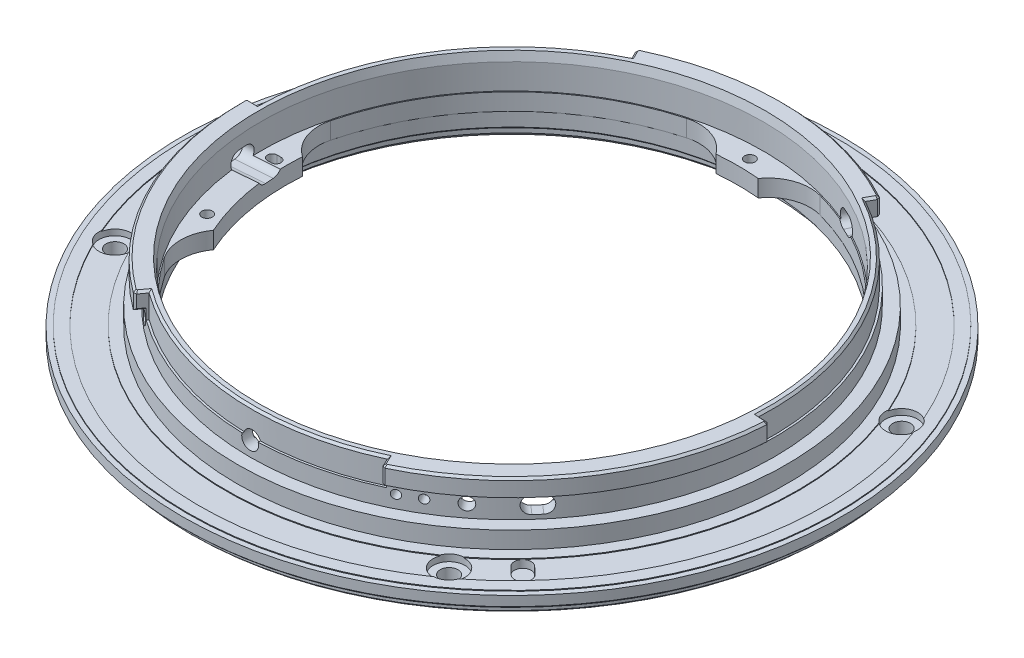
from build123d import *

# Parameters (mm, degrees)
SKETCH1_R                                        = 39
BOSS_EXTRUDE1_DEPTH                              = 2.5
SKETCH6_R                                        = 32.5
BOSS_EXTRUDE2_DEPTH                              = 7
CUT_EXTRUDE1_START                               = -0.1
SKETCH2_R                                        = 39
SKETCH2_R_2                                      = 38.4
CUT_EXTRUDE1_DEPTH                               = 0.1
SKETCH7_R                                        = 37
SKETCH7_R_2                                      = 33.8
CUT_EXTRUDE5_DEPTH                               = 0.1
SKETCH3_R                                        = 39
SKETCH3_R_2                                      = 38.15
CUT_EXTRUDE2_DEPTH                               = 1
SKETCH4_R                                        = 30.75
CUT_EXTRUDE3_DEPTH                               = 1.55
CUT_EXTRUDE4_START                               = 1.55
SKETCH5_R                                        = 29.75
CUT_EXTRUDE4_DEPTH                               = 3.5
CHAMFER1_SIZE                                    = 0.5
CHAMFER2_SIZE                                    = 0.25
CHAMFER3_SIZE                                    = 0.25
CUT_EXTRUDE6_START                               = -4
SKETCH11_R                                       = 29.75
CUT_EXTRUDE6_DEPTH                               = 4
CUT_EXTRUDE7_DEPTH                               = 56.479726027
M1_6X0_35_TAPPED_HOLE1_D                         = 1.25
F_1_0MM_DOWEL_HOLE2_D                            = 1
F_1_0MM_START                                    = 3.5
F_1_0MM_DOWEL_SLOT2_DEPTH                        = 2
CBORE_FOR_M2_PAN_HEAD_MACHINE_SCREW1_D           = 2.1
CBORE_FOR_M2_PAN_HEAD_MACHINE_SCREW1_CBORE_D     = 3.8
CBORE_FOR_M2_PAN_HEAD_MACHINE_SCREW1_CBORE_DEPTH = 0.8
CUT_EXTRUDE14_DEPTH                              = 56.596762496
CUT_EXTRUDE14_DEPTH_BACK                         = 1
CHAMFER4_SIZE                                    = 0.25
CHAMFER4_SIZE2                                   = 1
SKETCH17_R                                       = 32.5
SKETCH17_R_2                                     = 31
CUT_EXTRUDE8_DEPTH                               = 3
CUT_EXTRUDE9_START                               = -3
SKETCH18_R                                       = 104.133700614
CUT_EXTRUDE9_DEPTH                               = 3
CUT_EXTRUDE11_REACH                              = 88.314
CUT_EXTRUDE12_REACH                              = 87.209
CUT_EXTRUDE13_REACH                              = 83.453
CUT_EXTRUDE15_REACH                              = 82.355
SKETCH36_R                                       = 1
CUT_EXTRUDE16_REACH                              = 88.215
SKETCH38_R                                       = 0.75
CUT_EXTRUDE17_REACH                              = 88.215
SKETCH39_R                                       = 0.75
CUT_EXTRUDE18_REACH                              = 87.796
CUT_EXTRUDE18_END_RADIUS                         = 29.75
SKETCH40_R                                       = 0.5
CUT_EXTRUDE19_REACH                              = 87.36
CUT_EXTRUDE19_END_RADIUS                         = 29.75
SKETCH41_R                                       = 0.5
CHAMFER5_SIZE                                    = 0.25
CHAMFER6_SIZE                                    = 0.25
CHAMFER7_SIZE                                    = 0.25


# Read off the part's stored shape, not the designer's step: Ø1.0mm Dowel Slot2
with BuildPart() as part:
    # Sketch1 → Boss-Extrude1 (new body)
    with BuildSketch(Plane(origin=(0, 0, 0), x_dir=(1, 0, 0), z_dir=(0, 1, 0))):
        with Locations(Location((0, 0, 0), (0, 0, 270))):
            Circle(SKETCH1_R)
    extrude(amount=BOSS_EXTRUDE1_DEPTH)

    # Sketch6 → Boss-Extrude2 (add)
    with BuildSketch(Plane(origin=(0, 2.5, 0), x_dir=(1, 0, 0), z_dir=(0, 1, 0))):
        with Locations(Location((0, 0, 0), (0, 0, 270))):
            Circle(SKETCH6_R)
    extrude(amount=BOSS_EXTRUDE2_DEPTH)

    # Sketch2 → Cut-Extrude1 (cut)
    with BuildSketch(Plane(origin=(0, 2.5, 0), x_dir=(1, 0, 0), z_dir=(0, 1, 0)).offset(CUT_EXTRUDE1_START)):
        with Locations(Location((0, 0, 0), (0, 0, 270))):
            Circle(SKETCH2_R)
        with Locations(Location((0, 0, 0), (0, 0, 270))):
            Circle(SKETCH2_R_2, mode=Mode.SUBTRACT)
    extrude(amount=CUT_EXTRUDE1_DEPTH, mode=Mode.SUBTRACT)

    # Sketch7 → Cut-Extrude5 (cut)
    with BuildSketch(Plane(origin=(0, 2.5, 0), x_dir=(1, 0, 0), z_dir=(0, 1, 0))):
        with Locations(Location((0, 0, 0), (0, 0, 270))):
            Circle(SKETCH7_R)
        with Locations(Location((0, 0, 0), (0, 0, 270))):
            Circle(SKETCH7_R_2, mode=Mode.SUBTRACT)
    extrude(amount=-CUT_EXTRUDE5_DEPTH, mode=Mode.SUBTRACT)

    # Sketch3 → Cut-Extrude2 (cut)
    with BuildSketch(Plane.XZ):
        with Locations(Location((0, 0, 0), (0, 0, 270))):
            Circle(SKETCH3_R)
        with Locations(Location((0, 0, 0), (0, 0, 270))):
            Circle(SKETCH3_R_2, mode=Mode.SUBTRACT)
    extrude(amount=-CUT_EXTRUDE2_DEPTH, mode=Mode.SUBTRACT)

    # Sketch4 → Cut-Extrude3 (cut)
    with BuildSketch(Plane.XZ):
        with Locations(Location((0, 0, 0), (0, 0, 270))):
            Circle(SKETCH4_R)
    extrude(amount=-CUT_EXTRUDE3_DEPTH, mode=Mode.SUBTRACT)

    # Sketch5 → Cut-Extrude4 (cut)
    with BuildSketch(Plane.XZ.offset(-1.55).offset(CUT_EXTRUDE4_START)):
        with Locations(Location((0, 0, 0), (0, 0, 270))):
            Circle(SKETCH5_R)
    extrude(amount=-CUT_EXTRUDE4_DEPTH, mode=Mode.SUBTRACT)

    # Chamfer1
    chamfer1_edges = [part.edges().sort_by_distance(p)[0] for p in [
        (0, 0, 30.75),
    ]]
    chamfer(chamfer1_edges, length=CHAMFER1_SIZE)

    # Chamfer2
    chamfer2_edges = [part.edges().sort_by_distance(p)[0] for p in [
        (0, 1.55, 29.75),
    ]]
    chamfer(chamfer2_edges, length=CHAMFER2_SIZE)

    # Chamfer3
    chamfer3_edges = [part.edges().sort_by_distance(p)[0] for p in [
        (0, 1, -39),
        (0, 0, 38.15),
    ]]
    chamfer(chamfer3_edges, length=CHAMFER3_SIZE)

    # Sketch11 → Cut-Extrude6 (cut)
    with BuildSketch(Plane(origin=(0, 9.5, 0), x_dir=(1, 0, 0), z_dir=(0, 1, 0)).offset(CUT_EXTRUDE6_START)):
        with Locations(Location((0, 0, 0), (0, 0, 90))):
            Circle(SKETCH11_R)
    extrude(amount=CUT_EXTRUDE6_DEPTH, mode=Mode.SUBTRACT)

    # Sketch10 → Cut-Extrude7 (cut, through all)
    with BuildSketch(Plane.XZ.offset(-3.5)):
        with BuildLine():
            ThreePointArc((24.42534022, 10.907119471), (25.371160244, 13.762107574), (24.508061845, 16.643182676))
            ThreePointArc((24.508061845, 16.643182676), (0, 29.625), (-24.508061845, 16.643182676))
            ThreePointArc((-24.508061845, 16.643182676), (-25.371160244, 13.762107574), (-24.42534022, 10.907119471))
            ThreePointArc((-24.42534022, 10.907119471), (-26.343607393, 4.645088753), (-26.682766529, -1.895381318))
            ThreePointArc((-26.682766529, -1.895381318), (-28.548010067, -4.254703071), (-28.72234859, -7.257225122))
            ThreePointArc((-28.72234859, -7.257225122), (-21.184234387, -20.709148665), (-7.906718086, -28.550384132))
            ThreePointArc((-7.906718086, -28.550384132), (-4.901014594, -28.444181003), (-2.5, -26.632921357))
            ThreePointArc((-2.5, -26.632921357), (0, -26.75), (2.5, -26.632921357))
            ThreePointArc((2.5, -26.632921357), (4.901014594, -28.444181003), (7.906718086, -28.550384132))
            ThreePointArc((7.906718086, -28.550384132), (21.184234387, -20.709148665), (28.72234859, -7.257225122))
            ThreePointArc((28.72234859, -7.257225122), (28.548010067, -4.254703071), (26.682766529, -1.895381318))
            ThreePointArc((26.682766529, -1.895381318), (26.343607393, 4.645088753), (24.42534022, 10.907119471))
        make_face()
    extrude(amount=-CUT_EXTRUDE7_DEPTH, mode=Mode.SUBTRACT)

    # M1.6x0.35 Tapped Hole1 (through all)
    with Locations(Plane(origin=(0, 3.5, -28.147502082), x_dir=(0, 0, -1), z_dir=(0, -1, 0))):
        with Locations((0, 0), (-37.774514778, 26.45), (-37.774514778, -26.45)):
            Hole(M1_6X0_35_TAPPED_HOLE1_D / 2)

    # Ø1.0mm Dowel Hole2 (through all)
    with Locations(Plane(origin=(28.147502082, 3.5, 0), x_dir=(0, 0, -1), z_dir=(0, -1, 0))):
        with Locations((0, 0)):
            Hole(F_1_0MM_DOWEL_HOLE2_D / 2)

    # Ø1.0mm Dowel Slot2 outline → Ø1.0mm Dowel Slot2 (cut)
    with BuildSketch(Plane(origin=(0, 0, 0), x_dir=(1, 0, 0), z_dir=(0, 1, 0)).offset(F_1_0MM_START)):
        with BuildLine():
            ThreePointArc((-27.922502082, -0.575), (-27.347502082, 0), (-27.922502082, 0.575))
            Line((-27.922502082, 0.575), (-28.372502082, 0.575))
            ThreePointArc((-28.372502082, 0.575), (-28.947502082, 0), (-28.372502082, -0.575))
            Line((-28.372502082, -0.575), (-27.922502082, -0.575))
        make_face()
    extrude(amount=F_1_0MM_DOWEL_SLOT2_DEPTH, mode=Mode.SUBTRACT)

    # CBORE for M2 Pan Head Machine Screw1 (through all)
    with Locations(Plane(origin=(-15.18302896, 2.5, -31.978674638), x_dir=(0, 0, 1), z_dir=(0, 1, 0))):
        with Locations((0, 0), (18.683355915, 47.991480616), (60.454624943, 36.213489113), (46.825556763, -16.953089212)):
            CounterBoreHole(CBORE_FOR_M2_PAN_HEAD_MACHINE_SCREW1_D / 2, CBORE_FOR_M2_PAN_HEAD_MACHINE_SCREW1_CBORE_D / 2, CBORE_FOR_M2_PAN_HEAD_MACHINE_SCREW1_CBORE_DEPTH)

    # Sketch34 → Cut-Extrude14 (cut, two sides: drawn at the far end of the back side and taken through both)
    with BuildSketch(Plane(origin=(0, 2.5, 0), x_dir=(1, 0, 0), z_dir=(0, 1, 0)).offset(-CUT_EXTRUDE14_DEPTH_BACK)):
        with BuildLine():
            Line((25.416105281, -25.515124776), (24.545948074, -24.68879165))
            ThreePointArc((24.545948074, -24.68879165), (24.509428006, -23.275049706), (25.92316995, -23.238529638))
            Line((25.92316995, -23.238529638), (26.793327157, -24.064862764))
            ThreePointArc((26.793327157, -24.064862764), (26.829847225, -25.478604708), (25.416105281, -25.515124776))
        make_face()
    extrude(amount=CUT_EXTRUDE14_DEPTH + CUT_EXTRUDE14_DEPTH_BACK, mode=Mode.SUBTRACT)

    # Chamfer4
    chamfer4_edges = [part.edges().sort_by_distance(p)[0] for p in [
        (0, 9.5, 29.75),
    ]]
    chamfer4_side = [part.faces().sort_by_distance(p)[0] for p in [
        (0, 9.5, -31.580761184),
    ]]
    chamfer(chamfer4_edges, length=CHAMFER4_SIZE, length2=CHAMFER4_SIZE2, reference=chamfer4_side[0])

    # Sketch17 → Cut-Extrude8 (cut)
    with BuildSketch(Plane(origin=(0, 4.5, 0), x_dir=(1, 0, 0), z_dir=(0, 1, 0))):
        with Locations(Location((0, 0, 0), (0, 0, 270))):
            Circle(SKETCH17_R)
        with Locations(Location((0, 0, 0), (0, 0, 270))):
            Circle(SKETCH17_R_2, mode=Mode.SUBTRACT)
    extrude(amount=CUT_EXTRUDE8_DEPTH, mode=Mode.SUBTRACT)

    # Sketch18 → Cut-Extrude9 (cut)
    with BuildSketch(Plane(origin=(0, 9.5, 0), x_dir=(1, 0, 0), z_dir=(0, 1, 0)).offset(CUT_EXTRUDE9_START)):
        Circle(SKETCH18_R)
        with BuildLine():
            Line((-14.062220953, 28.800285448), (-13.491834455, 27.632099143))
            ThreePointArc((-13.491834455, 27.632099143), (-25.913549143, 16.554469814), (-30.74360643, 0.627027649))
            Line((-30.74360643, 0.627027649), (-32.043336133, 0.653536135))
            ThreePointArc((-32.043336133, 0.653536135), (-28.699015677, -14.267760832), (-18.821729371, -25.941183541))
            Line((-18.821729371, -25.941183541), (-18.05828949, -24.888967048))
            ThreePointArc((-18.05828949, -24.888967048), (-2.89198601, -30.613704724), (13.078054101, -27.830325203))
            Line((13.078054101, -27.830325203), (13.630947446, -29.006891797))
            ThreePointArc((13.630947446, -29.006891797), (26.619128391, -17.850056127), (32.0101004, -1.59874088))
            Line((32.0101004, -1.59874088), (30.711718792, -1.533893356))
            ThreePointArc((30.711718792, -1.533893356), (26.889448045, 14.917107086), (14.955513439, 26.868105958))
            Line((14.955513439, 26.868105958), (15.587779047, 28.003993365))
            ThreePointArc((15.587779047, 28.003993365), (0.860437183, 32.038447963), (-14.062220953, 28.800285448))
        make_face(mode=Mode.SUBTRACT)
    extrude(amount=CUT_EXTRUDE9_DEPTH, mode=Mode.SUBTRACT)

    # Sketch28 → Cut-Extrude11 (cut, up to next)
    with BuildSketch(Plane(origin=(23.401002226, 6, 20.332070599), x_dir=(0.6558732451184393, 0, -0.7548710395410649), z_dir=(0.7548710395410649, 0, 0.6558732451184391)), mode=Mode.PRIVATE) as cut_extrude11_sk1:
        with BuildLine():
            Line((-0.5, 1), (0.5, 1))
            ThreePointArc((0.5, 1), (1.5, 0), (0.5, -1))
            Line((0.5, -1), (-0.5, -1))
            ThreePointArc((-0.5, -1), (-1.5, 0), (-0.5, 1))
        make_face()
    cut_extrude11_tool1 = extrude(cut_extrude11_sk1.sketch, amount=-CUT_EXTRUDE11_REACH, mode=Mode.PRIVATE) & part.part
    add(cut_extrude11_tool1.solids().sort_by_distance((23.401002, 6, 20.332071))[0], mode=Mode.SUBTRACT)

    # Sketch29 → Cut-Extrude12 (cut, up to next)
    with BuildSketch(Plane(origin=(13.299115402, 6, -28.002384354), x_dir=(-0.9033027211058134, 0, -0.42900372264449294), z_dir=(0.42900372264449294, 0, -0.9033027211058134)), mode=Mode.PRIVATE) as cut_extrude12_sk1:
        with BuildLine():
            Line((-0.5, 1), (0.5, 1))
            ThreePointArc((0.5, 1), (1.5, 0), (0.5, -1))
            Line((0.5, -1), (-0.5, -1))
            ThreePointArc((-0.5, -1), (-1.5, 0), (-0.5, 1))
        make_face()
    cut_extrude12_tool1 = extrude(cut_extrude12_sk1.sketch, amount=-CUT_EXTRUDE12_REACH, mode=Mode.PRIVATE) & part.part
    add(cut_extrude12_tool1.solids().sort_by_distance((13.299115, 6, -28.002384))[0], mode=Mode.SUBTRACT)

    # Sketch30 → Cut-Extrude13 (cut, up to next)
    with BuildSketch(Plane(origin=(-30.909434968, 6, 2.367874565), x_dir=(0.07638305048549095, 0, 0.9970785473564914), z_dir=(-0.9970785473564914, 0, 0.07638305048549095)), mode=Mode.PRIVATE) as cut_extrude13_sk1:
        with BuildLine():
            Line((-0.5, 1), (0.5, 1))
            ThreePointArc((0.5, 1), (1.5, 0), (0.5, -1))
            Line((0.5, -1), (-0.5, -1))
            ThreePointArc((-0.5, -1), (-1.5, 0), (-0.5, 1))
        make_face()
    cut_extrude13_tool1 = extrude(cut_extrude13_sk1.sketch, amount=-CUT_EXTRUDE13_REACH, mode=Mode.PRIVATE) & part.part
    add(cut_extrude13_tool1.solids().sort_by_distance((-30.909435, 6, 2.367875))[0], mode=Mode.SUBTRACT)

    # Sketch36 → Cut-Extrude15 (cut, up to next)
    with BuildSketch(Plane(origin=(0, 6, 31), x_dir=(1, 0, 0), z_dir=(0, 0, 1)), mode=Mode.PRIVATE) as cut_extrude15_sk1:
        with Locations(Location((0, 0.2, 0), (0, 0, 17.457603124))):
            Circle(SKETCH36_R)
    cut_extrude15_tool1 = extrude(cut_extrude15_sk1.sketch, amount=-CUT_EXTRUDE15_REACH, mode=Mode.PRIVATE) & part.part
    add(cut_extrude15_tool1.solids().sort_by_distance((0, 6.2, 31))[0], mode=Mode.SUBTRACT)

    # Sketch38 → Cut-Extrude16 (cut, up to next)
    with BuildSketch(Plane(origin=(-19.085505735, 6, 24.428333362), x_dir=(0.7880107536067209, 0, 0.6156614753256596), z_dir=(-0.6156614753256596, 0, 0.7880107536067209)), mode=Mode.PRIVATE) as cut_extrude16_sk1:
        with Locations(Location((0, 0, 0), (0, 0, 318.189685104))):
            Circle(SKETCH38_R)
    cut_extrude16_tool1 = extrude(cut_extrude16_sk1.sketch, amount=-CUT_EXTRUDE16_REACH, mode=Mode.PRIVATE) & part.part
    add(cut_extrude16_tool1.solids().sort_by_distance((-19.085506, 6, 24.428333))[0], mode=Mode.SUBTRACT)

    # Sketch39 → Cut-Extrude17 (cut, up to next)
    with BuildSketch(Plane(origin=(19.085505735, 6, 24.428333362), x_dir=(0.788010753606721, 0, -0.6156614753256596), z_dir=(0.6156614753256596, 0, 0.788010753606721)), mode=Mode.PRIVATE) as cut_extrude17_sk1:
        with Locations(Location((0, 0, 0), (0, 0, 318.189685104))):
            Circle(SKETCH39_R)
    cut_extrude17_tool1 = extrude(cut_extrude17_sk1.sketch, amount=-CUT_EXTRUDE17_REACH, mode=Mode.PRIVATE) & part.part
    add(cut_extrude17_tool1.solids().sort_by_distance((19.085506, 6, 24.428333))[0], mode=Mode.SUBTRACT)

    # Cut-Extrude18: up to this cylinder (the profile starts outside it)
    cut_extrude18_end = Plane(origin=(0, 6, 0), z_dir=(0, 1, 0)) * Cylinder(CUT_EXTRUDE18_END_RADIUS, 236.092, mode=Mode.PRIVATE)
    # Sketch40 → Cut-Extrude18 (cut, up to the surface)
    with BuildSketch(Plane(origin=(16.092112855, 6, 26.496111108), x_dir=(0.8547132615611811, 0, -0.5191004146708498), z_dir=(0.5191004146708498, 0, 0.8547132615611811)), mode=Mode.PRIVATE) as cut_extrude18_sk1:
        Circle(SKETCH40_R)
    cut_extrude18_tool1 = extrude(cut_extrude18_sk1.sketch, amount=-CUT_EXTRUDE18_REACH, mode=Mode.PRIVATE) - cut_extrude18_end
    add(cut_extrude18_tool1.solids().sort_by_distance((16.092113, 6, 26.496111))[0], mode=Mode.SUBTRACT)

    # Cut-Extrude19: up to this cylinder (the profile starts outside it)
    cut_extrude19_end = Plane(origin=(0, 6, 0), z_dir=(0, 1, 0)) * Cylinder(CUT_EXTRUDE19_END_RADIUS, 235.22, mode=Mode.PRIVATE)
    # Sketch41 → Cut-Extrude19 (cut, up to the surface)
    with BuildSketch(Plane(origin=(13.948621059, 6, 27.684580014), x_dir=(0.8930509681969089, 0, -0.44995551802657524), z_dir=(0.44995551802657524, 0, 0.8930509681969089)), mode=Mode.PRIVATE) as cut_extrude19_sk1:
        with Locations(Location((0, 0, 0), (0, 0, 270.000000003))):
            Circle(SKETCH41_R)
    cut_extrude19_tool1 = extrude(cut_extrude19_sk1.sketch, amount=-CUT_EXTRUDE19_REACH, mode=Mode.PRIVATE) - cut_extrude19_end
    add(cut_extrude19_tool1.solids().sort_by_distance((13.948621, 6, 27.68458))[0], mode=Mode.SUBTRACT)

    # Chamfer5
    chamfer5_edges = [part.edges().sort_by_distance(p)[0] for p in [
        (15.587779047, 8.5, -28.003993365),
        (13.630947446, 8.5, 29.006891797),
        (-32.043336133, 8.5, -0.653536135),
        (32.0101004, 8.5, 1.59874088),
        (-18.821729371, 8.5, 25.941183541),
        (-14.062220953, 8.5, -28.800285448),
    ]]
    chamfer(chamfer5_edges, length=CHAMFER5_SIZE)

    # Chamfer6
    chamfer6_edges = [part.edges().sort_by_distance(p)[0] for p in [
        (15.210851473, 9.5, -27.326829719),
        (13.301337952, 9.5, 28.305477097),
        (-31.268497272, 9.5, -0.637732999),
        (26.889448045, 9.5, -14.917107086),
        (-2.89198601, 9.5, 30.613704724),
        (-25.913549143, 9.5, -16.554469814),
        (0.860437183, 9.5, -32.038447963),
        (-13.722182848, 9.5, -28.103866689),
        (-28.699015677, 9.5, 14.267760832),
        (-18.36660175, 9.5, 25.313900631),
        (26.619128391, 9.5, 17.850056127),
        (31.236065211, 9.5, 1.560081779),
        (-13.894837442, 9.5, -28.742366193),
        (15.417528056, 9.5, -27.955141755),
        (31.87853381, 9.5, 1.717324658),
        (13.690707824, 9.5, 28.840156747),
        (-18.849209282, 9.5, 25.766207158),
        (-31.920423578, 9.5, -0.526004242),
    ]]
    chamfer(chamfer6_edges, length=CHAMFER6_SIZE)

    # Chamfer7
    chamfer7_edges = [part.edges().sort_by_distance(p)[0] for p in [
        (31.360909596, 7.5, 1.566317118),
        (-18.44000943, 7.5, 25.415075294),
        (-13.777027704, 7.5, -28.216192295),
    ]]
    chamfer(chamfer7_edges, length=CHAMFER7_SIZE)


solid = part.part
